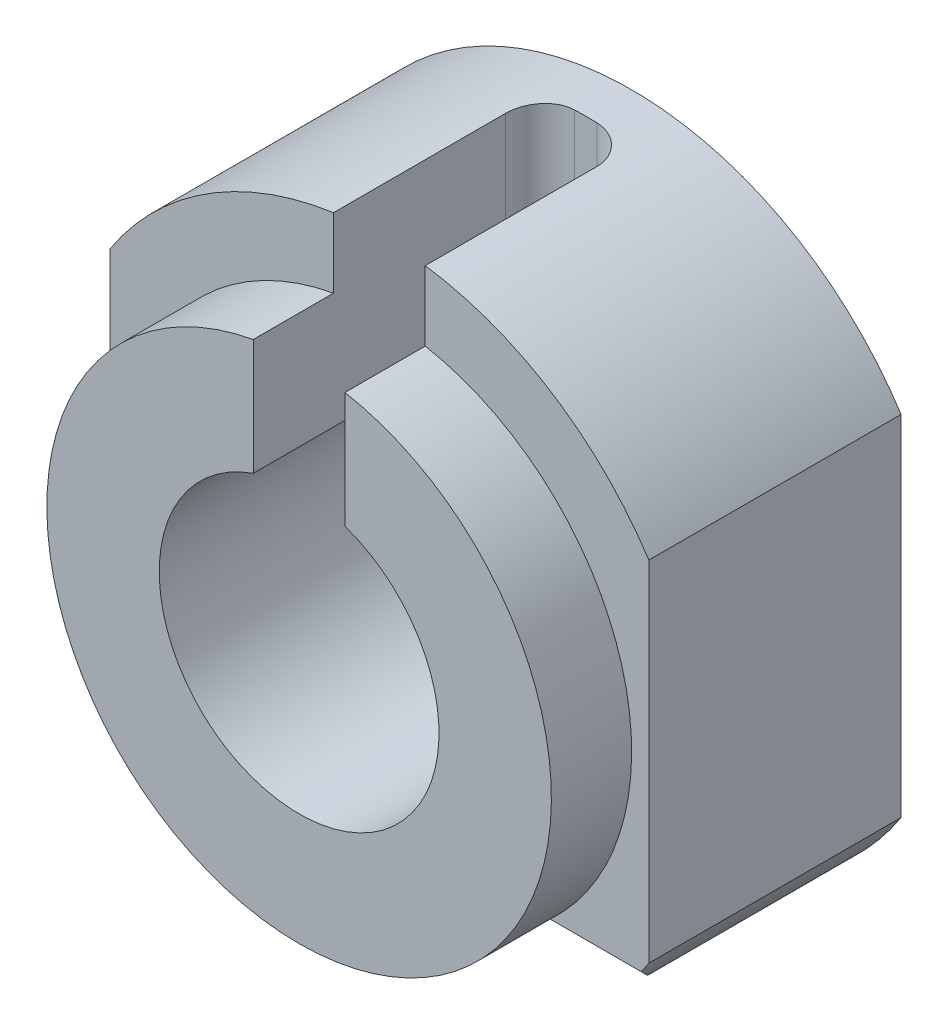
from build123d import *
from build123d.topology import SkipClean

# Parameters (mm, degrees)
SKETCH1_R               = 9.1
SKETCH1_R_2             = 6.1
BOSS_EXTRUDE1_DEPTH     = 12
BOSS_EXTRUDE2_START     = -3
SKETCH2_R               = 11
SKETCH2_R_2             = 9.1
BOSS_EXTRUDE2_DEPTH     = 3
BOSS_EXTRUDE3_START     = 4
SKETCH3_R               = 14
SKETCH3_R_2             = 11
SKETCH3_R_3             = 9.1
BOSS_EXTRUDE3_DEPTH     = 4
BOSS_EXTRUDE4_START     = 2
SKETCH4_R               = 9.1
SKETCH4_R_2             = 1.5
BOSS_EXTRUDE4_DEPTH     = 2
CUT_EXTRUDE3_DEPTH      = 23.649503306
CUT_EXTRUDE3_DEPTH_BACK = 23.649503306
SKETCH5_W               = 4
SKETCH5_H               = 12
CUT_EXTRUDE1_DEPTH      = 22.864640404
CUT_EXTRUDE4_DEPTH      = 22.864640404
CUT_EXTRUDE4_DEPTH_BACK = 22.864640404
SKETCH7_W               = 8
SKETCH7_H               = 10
BOSS_EXTRUDE5_START     = -14
SKETCH2_2_R             = 11
SKETCH2_2_R_2           = 9.1
SKETCH2_2_R_3           = 6.1
BOSS_EXTRUDE5_DEPTH     = 14
BOSS_EXTRUDE6_START     = 7
BOSS_EXTRUDE6_DEPTH     = 7
CUT_EXTRUDE5_START      = 5.762811814
CUT_EXTRUDE5_OUTLINE_W  = 4
CUT_EXTRUDE5_OUTLINE_H  = 12
CUT_EXTRUDE5_DEPTH      = 5.237188186
BOSS_EXTRUDE7_START     = -2
SKETCH11_R              = 14
SKETCH11_R_2            = 1.5
BOSS_EXTRUDE7_DEPTH     = 2
CUT_EXTRUDE6_DEPTH      = 24.151673806
CUT_EXTRUDE6_DEPTH_BACK = 24.151673806
FILLET1_R               = 1.5
BOSS_EXTRUDE8_DEPTH     = 0.5


# Read off the part's stored shape, not the designer's step: Cut-Extrude5
with BuildPart() as part:
    # Sketch1 → Boss-Extrude1 (new body)
    with BuildSketch(Plane.XY):
        Circle(SKETCH1_R)
        Circle(SKETCH1_R_2, mode=Mode.SUBTRACT)
    extrude(amount=BOSS_EXTRUDE1_DEPTH)

    # Sketch2 → Boss-Extrude2 (add)
    with BuildSketch(Plane.XY.offset(12).offset(BOSS_EXTRUDE2_START)):
        Circle(SKETCH2_R)
        Circle(SKETCH2_R_2, mode=Mode.SUBTRACT)
    extrude(amount=BOSS_EXTRUDE2_DEPTH)

    # Sketch3 → Boss-Extrude3 (add)
    # profile 1 of 2: a face of its own
    with BuildSketch(Plane(origin=(0, 0, 9), x_dir=(-1, 0, 0), z_dir=(0, 0, -1)).offset(BOSS_EXTRUDE3_START)):
        Circle(SKETCH3_R)
        with Locations(Location((0, 0, 0), (0, 0, 180))):
            Circle(SKETCH3_R_2, mode=Mode.SUBTRACT)
    # profile 2 of 2: a face of its own
    with BuildSketch(Plane(origin=(0, 0, 9), x_dir=(-1, 0, 0), z_dir=(0, 0, -1)).offset(BOSS_EXTRUDE3_START)):
        with Locations(Location((0, 0, 0), (0, 0, 180))):
            Circle(SKETCH3_R_2)
        Circle(SKETCH3_R_3, mode=Mode.SUBTRACT)
    extrude(amount=-BOSS_EXTRUDE3_DEPTH)

    # Sketch4 → Boss-Extrude4 (add)
    with BuildSketch(Plane(origin=(0, 0, 0), x_dir=(-1, 0, 0), z_dir=(0, 0, -1)).offset(BOSS_EXTRUDE4_START)):
        Circle(SKETCH4_R)
        Circle(SKETCH4_R_2, mode=Mode.SUBTRACT)
    extrude(amount=-BOSS_EXTRUDE4_DEPTH)

    # Sketch6 → Cut-Extrude3 (cut, two sides: drawn at the far end of the back side and taken through both)
    with BuildSketch(Plane.XY.offset(9).offset(-CUT_EXTRUDE3_DEPTH_BACK)):
        with BuildLine():
            ThreePointArc((11.75, -7.611668674), (14, 0), (11.75, 7.611668674))
            Line((11.75, 7.611668674), (11.75, -7.611668674))
        make_face()
        with BuildLine():
            Line((-11.75, -7.611668674), (-11.75, 7.611668674))
            ThreePointArc((-11.75, 7.611668674), (-14, 0), (-11.75, -7.611668674))
        make_face()
    extrude(amount=CUT_EXTRUDE3_DEPTH + CUT_EXTRUDE3_DEPTH_BACK, mode=Mode.SUBTRACT)

    # Sketch5 → Cut-Extrude1 (cut, through all)
    with BuildSketch(Plane(origin=(0, 0, 0), x_dir=(1, 0, 0), z_dir=(0, 1, 0))):
        with Locations((0, -6)):
            Rectangle(SKETCH5_W, SKETCH5_H)
    extrude(amount=CUT_EXTRUDE1_DEPTH, mode=Mode.SUBTRACT)

    # Sketch7 → Cut-Extrude4 (cut, two sides: drawn at the far end of the back side and taken through both)
    with BuildSketch(Plane(origin=(0, 0, 0), x_dir=(0, 0, -1), z_dir=(1, 0, 0)).offset(-CUT_EXTRUDE4_DEPTH_BACK)):
        with Locations((-8, -18.1)):
            Rectangle(SKETCH7_W, SKETCH7_H)
        Polygon((-12, -13.1), (-12, -6.1), (-12, -5.1), (-4, -13.1), align=None)
    extrude(amount=CUT_EXTRUDE4_DEPTH + CUT_EXTRUDE4_DEPTH_BACK, mode=Mode.SUBTRACT)

    # Sketch2<2> → Boss-Extrude5 (add)
    # profile 1 of 2: a face of its own
    with BuildSketch(Plane.XY.offset(12).offset(BOSS_EXTRUDE5_START)):
        Circle(SKETCH2_2_R)
        Circle(SKETCH2_2_R_2, mode=Mode.SUBTRACT)
    # profile 2 of 2: a face of its own
    with BuildSketch(Plane.XY.offset(12).offset(BOSS_EXTRUDE5_START)):
        Circle(SKETCH2_2_R_2)
        Circle(SKETCH2_2_R_3, mode=Mode.SUBTRACT)
    extrude(amount=BOSS_EXTRUDE5_DEPTH)

    # Sketch10 → Boss-Extrude6 (add)
    with BuildSketch(Plane(origin=(0, 0, 5), x_dir=(-1, 0, 0), z_dir=(0, 0, -1)).offset(BOSS_EXTRUDE6_START)):
        with BuildLine():
            Line((2, 13.856406461), (2, 10.816653826))
            ThreePointArc((2, 10.816653826), (0, -11), (-2, 10.816653826))
            Line((-2, 10.816653826), (-2, 13.856406461))
            ThreePointArc((-2, 13.856406461), (-7.550815354, 11.789197916), (-11.75, 7.611668674))
            Line((-11.75, 7.611668674), (-11.75, -7.611668674))
            ThreePointArc((-11.75, -7.611668674), (-9.660292592, -10.133052207), (-7.042016757, -12.1))
            Line((-7.042016757, -12.1), (7.042016757, -12.1))
            ThreePointArc((7.042016757, -12.1), (9.660292592, -10.133052207), (11.75, -7.611668674))
            Line((11.75, -7.611668674), (11.75, 7.611668674))
            ThreePointArc((11.75, 7.611668674), (7.550815354, 11.789197916), (2, 13.856406461))
        make_face()
    extrude(amount=-BOSS_EXTRUDE6_DEPTH)

    # Cut-Extrude5 outline → Cut-Extrude5 (cut)
    with BuildSketch(Plane(origin=(0, 0, 0), x_dir=(1, 0, 0), z_dir=(0, 1, 0)).offset(CUT_EXTRUDE5_START)):
        with Locations((0, -6)):
            Rectangle(CUT_EXTRUDE5_OUTLINE_W, CUT_EXTRUDE5_OUTLINE_H)
    extrude(amount=CUT_EXTRUDE5_DEPTH, mode=Mode.SUBTRACT)

    # Sketch11 → Boss-Extrude7 (add)
    with SkipClean():  # the faces are left unmerged after this step: merging them gives an invalid solid
        with BuildSketch(Plane.XY.offset(BOSS_EXTRUDE7_START)):
            with Locations(Location((0, 0, 0), (0, 0, 327.064769503))):
                Circle(SKETCH11_R)
            with Locations(Location((0, 0, 0), (0, 0, 180))):
                Circle(SKETCH11_R_2, mode=Mode.SUBTRACT)
        extrude(amount=BOSS_EXTRUDE7_DEPTH)

    # Sketch12 → Cut-Extrude6 (cut, two sides: drawn at the far end of the back side and taken through both)
    with SkipClean():  # the faces are left unmerged after this step: merging them gives an invalid solid
        with BuildSketch(Plane.XY.offset(-CUT_EXTRUDE6_DEPTH_BACK)):
            with BuildLine():
                Line((11.75, 7.611668674), (11.75, -7.611668674))
                ThreePointArc((11.75, -7.611668674), (14, 0), (11.75, 7.611668674))
            make_face()
            with BuildLine():
                Line((-11.75, -7.611668674), (-11.75, 7.611668674))
                ThreePointArc((-11.75, 7.611668674), (-14, 0), (-11.75, -7.611668674))
            make_face()
            with BuildLine():
                Line((7.042016757, -12.1), (-7.042016757, -12.1))
                ThreePointArc((-7.042016757, -12.1), (0, -14), (7.042016757, -12.1))
            make_face()
        extrude(amount=CUT_EXTRUDE6_DEPTH + CUT_EXTRUDE6_DEPTH_BACK, mode=Mode.SUBTRACT)

    # Fillet1
    # the kernel refuses this fillet: 1.5 mm, written as the material it adds along each edge
    with BuildSketch(Plane(origin=(-2, 2.012811814, 0), x_dir=(0, 0, 1), z_dir=(0, 1, 0))) as fillet1_piece_1_section:
        with BuildLine():
            CenterArc((FILLET1_R, FILLET1_R), FILLET1_R, 180, 90)
            Line((0, FILLET1_R), (0, 0))
            Line((0, 0), (FILLET1_R, 0))
        make_face()
    fillet1_piece_1 = extrude(amount=8.803842012, mode=Mode.PRIVATE)
    fillet1_piece_1 = fillet1_piece_1 - Plane(origin=(0, 0, 0.34289743), x_dir=(1, 0, 0), z_dir=(0, 0, -1)) * Cylinder(6.1, 24, mode=Mode.PRIVATE)
    add(fillet1_piece_1)
    with BuildSketch(Plane(origin=(2, 2.012811814, 0), x_dir=(0, 0, 1), z_dir=(0, 1, 0))) as fillet1_piece_2_section:
        with BuildLine():
            CenterArc((FILLET1_R, -FILLET1_R), FILLET1_R, 90, 90)
            Line((0, -FILLET1_R), (0, 0))
            Line((0, 0), (FILLET1_R, 0))
        make_face()
    fillet1_piece_2 = extrude(amount=8.803842012, mode=Mode.PRIVATE)
    fillet1_piece_2 = fillet1_piece_2 - Plane(origin=(0, 0, 0.342899139), x_dir=(1, 0, 0), z_dir=(0, 0, -1)) * Cylinder(6.1, 24, mode=Mode.PRIVATE)
    add(fillet1_piece_2)
    with BuildSketch(Plane(origin=(2, 10.816653826, 0), x_dir=(0, 0, 1), z_dir=(0, 1, 0))) as fillet1_piece_3_section:
        with BuildLine():
            CenterArc((FILLET1_R, -FILLET1_R), FILLET1_R, 90, 90)
            Line((0, -FILLET1_R), (0, 0))
            Line((0, 0), (FILLET1_R, 0))
        make_face()
    fillet1_piece_3 = extrude(amount=6.789752634, mode=Mode.PRIVATE)
    fillet1_piece_3 = fillet1_piece_3 & Plane(origin=(0, 0, 0.337347522), x_dir=(-1, 0, 0), z_dir=(0, 0, -1)) * Cylinder(14, 20, mode=Mode.PRIVATE)
    add(fillet1_piece_3)
    with BuildSketch(Plane(origin=(-2, 17.606406461, 0), x_dir=(0, 0, 1), z_dir=(0, -1, 0))) as fillet1_piece_4_section:
        with BuildLine():
            CenterArc((FILLET1_R, -FILLET1_R), FILLET1_R, 90, 90)
            Line((0, -FILLET1_R), (0, 0))
            Line((0, 0), (FILLET1_R, 0))
        make_face()
    fillet1_piece_4 = extrude(amount=6.789752634, mode=Mode.PRIVATE)
    fillet1_piece_4 = fillet1_piece_4 & Plane(origin=(0, 0, 0.337344923), x_dir=(-0.8392857142857146, 0.5436906195585112, 0), z_dir=(0, 0, -1)) * Cylinder(14, 20, mode=Mode.PRIVATE)
    add(fillet1_piece_4)

    # Sketch13 → Boss-Extrude8 (add)
    with BuildSketch(Plane.XY.offset(12)):
        with BuildLine():
            Line((-2, 5.762811814), (-2, 10.816653826))
            ThreePointArc((-2, 10.816653826), (0, -11), (2, 10.816653826))
            Line((2, 10.816653826), (2, 5.762811814))
            ThreePointArc((2, 5.762811814), (0, -6.1), (-2, 5.762811814))
        make_face()
    extrude(amount=BOSS_EXTRUDE8_DEPTH)


solid = part.part
